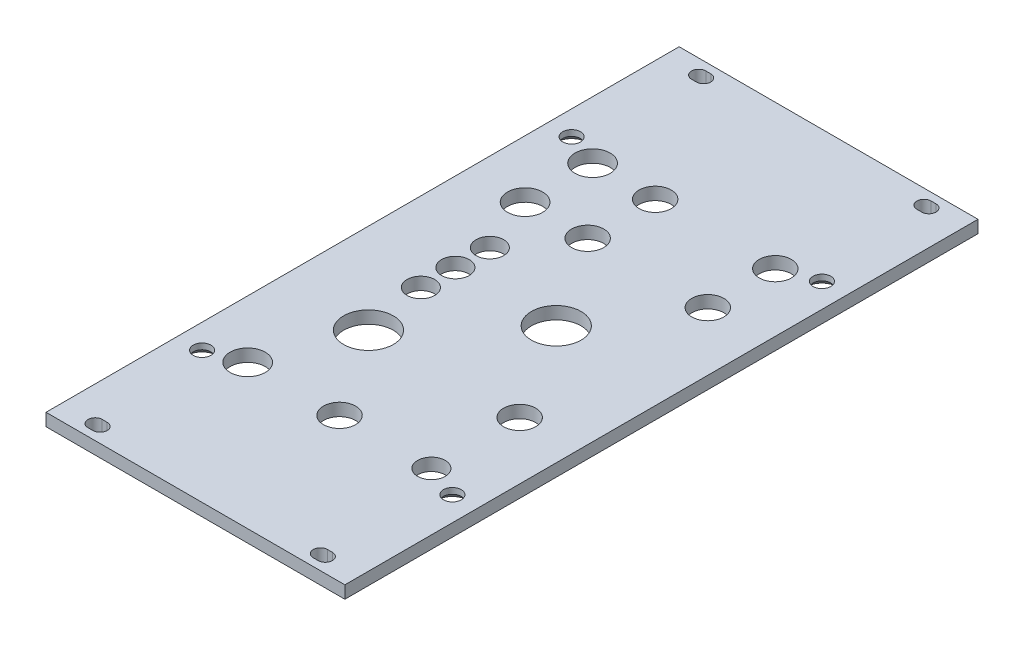
from build123d import *

# Parameters (mm, degrees)
SKETCH1_W                                      = 60.6552
SKETCH1_H                                      = 128.4986
BOSS_EXTRUDE1_DEPTH                            = 2.54
CSK_FOR_M3_FLAT_HEAD_MACHINE_SCREW1_AT_2_COUNT = 2
CSK_FOR_M3_FLAT_HEAD_MACHINE_SCREW1_AT_2_PITCH = 75.0062
M2_5_CLEARANCE_SLOT1_DEPTH                     = 2.54
F_1_4_CLEARANCE_HOLE1_D                        = 7.14248
F_1_4_CLEARANCE_HOLE2_D                        = 6.5278
F_3_8_CLEARANCE_HOLE2_D                        = 10.0838
F_10_CLEARANCE_HOLE1_D                         = 5.6134


# Read off the part's stored shape, not the designer's step: M2.5 Clearance Slot1
with BuildPart() as part:
    # Sketch1 → Boss-Extrude1 (new body)
    with BuildSketch(Plane(origin=(0, 0, 0), x_dir=(1, 0, 0), z_dir=(0, 1, 0))):
        Rectangle(SKETCH1_W, SKETCH1_H)
    extrude(amount=BOSS_EXTRUDE1_DEPTH)

    # Sketch5 → CSK for M3 Flat Head Machine Screw1 (revolve, cut)
    with BuildSketch(Plane(origin=(25.4, 0, -37.5031), x_dir=(0, 0, -1), z_dir=(1, 0, 0))):
        Polygon((0, 0), (0, 2.54), (1.8, 2.54), (1.8, 1.35), (3.15, 0), align=None)
    csk_for_m3_flat_head_machine_screw1 = revolve(axis=Axis((25.4, -6.35, -37.5031), (0, 1, 0)), mode=Mode.SUBTRACT)

    # CSK for M3 Flat Head Machine Screw1 at 2: CSK for M3 Flat Head Machine Screw1 ×2
    with Locations(*[(0, 0, i * CSK_FOR_M3_FLAT_HEAD_MACHINE_SCREW1_AT_2_PITCH) for i in range(1, CSK_FOR_M3_FLAT_HEAD_MACHINE_SCREW1_AT_2_COUNT)]):
        add(csk_for_m3_flat_head_machine_screw1, mode=Mode.SUBTRACT)

    # M2.5 Clearance Slot1 outline → M2.5 Clearance Slot1 (cut)
    with BuildSketch(Plane(origin=(0, 0, 0), x_dir=(1, 0, 0), z_dir=(0, 1, 0))):
        with BuildLine():
            ThreePointArc((23.36, -62.7021), (24.81, -61.2521), (23.36, -59.8021))
            Line((23.36, -59.8021), (22.36, -59.8021))
            ThreePointArc((22.36, -59.8021), (20.91, -61.2521), (22.36, -62.7021))
            Line((22.36, -62.7021), (23.36, -62.7021))
        make_face()
        with BuildLine():
            ThreePointArc((23.36, 59.8021), (24.81, 61.2521), (23.36, 62.7021))
            Line((23.36, 62.7021), (22.36, 62.7021))
            ThreePointArc((22.36, 62.7021), (20.91, 61.2521), (22.36, 59.8021))
            Line((22.36, 59.8021), (23.36, 59.8021))
        make_face()
    m2_5_clearance_slot1 = extrude(amount=M2_5_CLEARANCE_SLOT1_DEPTH, mode=Mode.SUBTRACT)

    # Mirror1: CSK for M3 Flat Head Machine Screw1, M2.5 Clearance Slot1 across plane
    add(csk_for_m3_flat_head_machine_screw1.mirror(Plane(origin=(0, 0, 0), x_dir=(0, 0, 1), z_dir=(1, 0, 0))), mode=Mode.SUBTRACT)
    add(m2_5_clearance_slot1.mirror(Plane(origin=(0, 0, 0), x_dir=(0, 0, 1), z_dir=(1, 0, 0))), mode=Mode.SUBTRACT)

    # Mirror1 copy 1 sketch → Mirror1 copy 1 (revolve, cut)
    with BuildSketch(Plane(origin=(-25.4, 0, 37.5031), x_dir=(0, 0, -1), z_dir=(-1, 0, 0))):
        Polygon((0, 0), (0, -2.54), (1.8, -2.54), (1.8, -1.35), (3.15, 0), align=None)
    revolve(axis=Axis((-25.4, -6.35, 37.5031), (0, -1, 0)), mode=Mode.SUBTRACT)

    # 1/4 Clearance Hole1 (through all)
    with Locations(Plane(origin=(0, 0, 0), x_dir=(-1, 0, 0), z_dir=(0, -1, 0))):
        with Locations((18.6436, 35.0012), (18.6436, 21.301199968), (18.6436, -35.0012)):
            Hole(F_1_4_CLEARANCE_HOLE1_D / 2)

    # 1/4 Clearance Hole2 (through all)
    with Locations(Plane(origin=(0, 0, 0), x_dir=(-1, 0, 0), z_dir=(0, -1, 0))):
        with Locations((-18.4404, 35.0012), (5.9436, 35.0012), (5.9436, 21.301199968), (-18.4404, 21.301199968), (-18.6436, -17.091200006), (0, -35.0012)):
            Hole(F_1_4_CLEARANCE_HOLE2_D / 2)

    # 3/8 Clearance Hole2 (through all)
    with Locations(Plane(origin=(0, 0, 0), x_dir=(-1, 0, 0), z_dir=(0, -1, 0))):
        with Locations((12.0396, -17.091200006), (-6.2484, 2.731200024)):
            Hole(F_3_8_CLEARANCE_HOLE2_D / 2)

    # #10 Clearance Hole1 (through all)
    with Locations(Plane(origin=(0, 0, 0), x_dir=(-1, 0, 0), z_dir=(0, -1, 0))):
        with Locations((14.224, -4.268799946), (14.224, 2.731200024), (14.224, 9.731199994), (-18.6436, -35.0012)):
            Hole(F_10_CLEARANCE_HOLE1_D / 2)


solid = part.part
